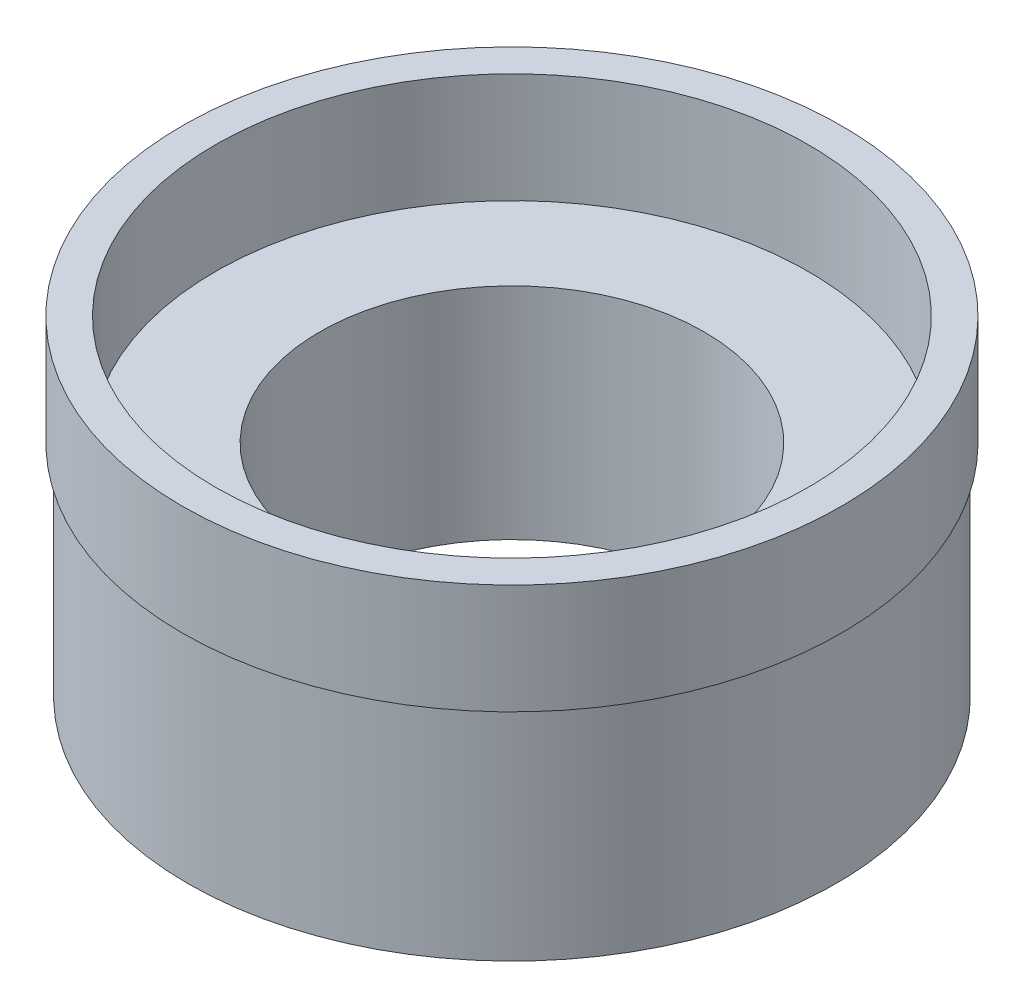
from build123d import *

# Parameters (mm, degrees)
SKETCH1_R           = 38.1
SKETCH1_R_2         = 34.29
BOSS_EXTRUDE1_DEPTH = 12.7
SKETCH2_R           = 37.465
SKETCH2_R_2         = 22.225
BOSS_EXTRUDE2_DEPTH = 25.4


with BuildPart() as part:
    # Sketch1 → Boss-Extrude1 (new body)
    with BuildSketch(Plane(origin=(0, 0, 0), x_dir=(1, 0, 0), z_dir=(0, 1, 0))):
        Circle(SKETCH1_R)
        Circle(SKETCH1_R_2, mode=Mode.SUBTRACT)
    extrude(amount=BOSS_EXTRUDE1_DEPTH)

    # Sketch2 → Boss-Extrude2 (add)
    with BuildSketch(Plane.XZ):
        Circle(SKETCH2_R)
        Circle(SKETCH2_R_2, mode=Mode.SUBTRACT)
    extrude(amount=BOSS_EXTRUDE2_DEPTH)


solid = part.part
